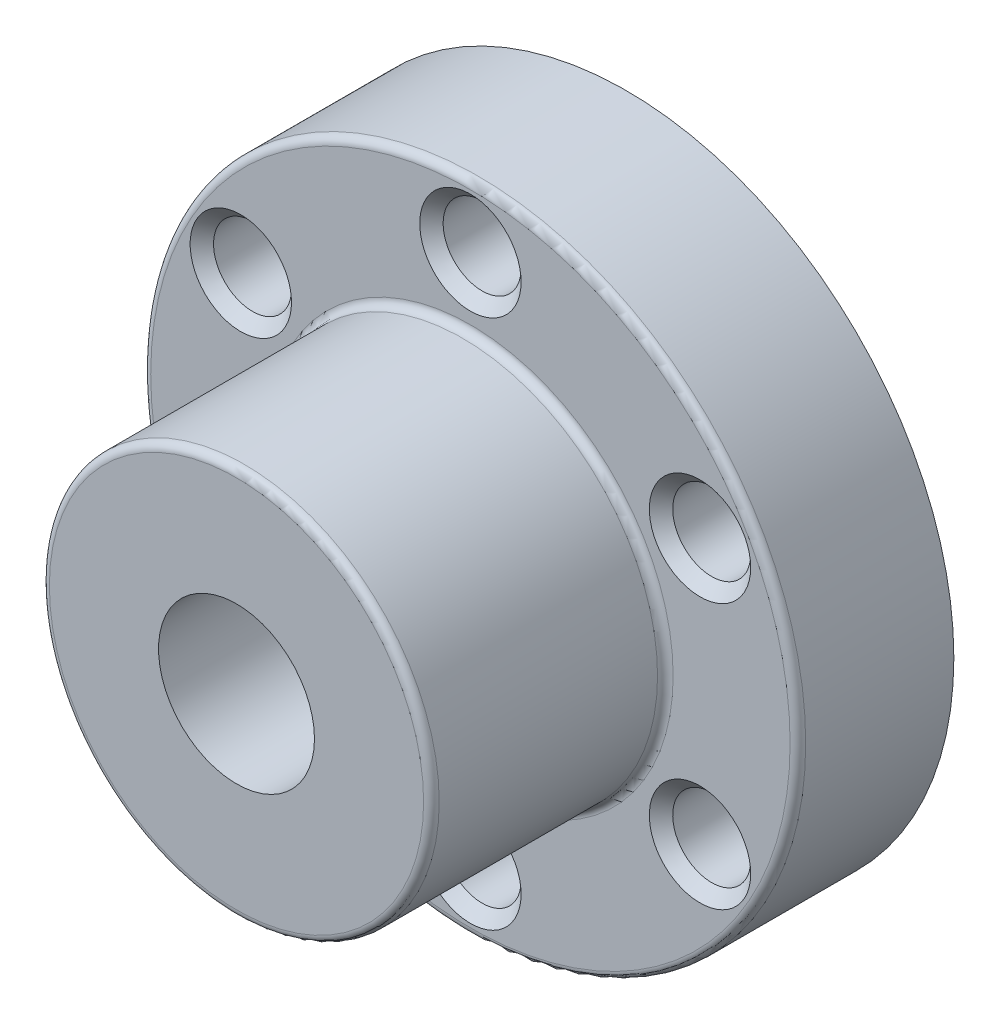
from build123d import *

# Parameters (mm, degrees)
SKETCH1_R                    = 21
BOSS_EXTRUDE1_DEPTH          = 10
SKETCH2_R                    = 12.5
BOSS_EXTRUDE2_DEPTH          = 15
SKETCH3_R                    = 5
CUT_EXTRUDE1_DEPTH           = 39.820097888
SKETCH4_R                    = 2.5
CUT_EXTRUDE2_DEPTH           = 39.820097888
FILLET1_R                    = 0.5
CHAMFER2_SIZE                = 0.75
CIRPATTERN2_COUNT            = 6
CHAMFER2_OF_CIRPATTERN2_SIZE = 0.75


with BuildPart() as part:
    # Sketch1 → Boss-Extrude1 (new body)
    with BuildSketch(Plane.XY):
        Circle(SKETCH1_R)
    extrude(amount=BOSS_EXTRUDE1_DEPTH)

    # Sketch2 → Boss-Extrude2 (add)
    with BuildSketch(Plane.XY.offset(10)):
        Circle(SKETCH2_R)
    extrude(amount=BOSS_EXTRUDE2_DEPTH)

    # Sketch3 → Cut-Extrude1 (cut, through all)
    with BuildSketch(Plane.XY.offset(25)):
        Circle(SKETCH3_R)
    extrude(amount=-CUT_EXTRUDE1_DEPTH, mode=Mode.SUBTRACT)

    # Sketch4 → Cut-Extrude2 (cut, through all)
    with BuildSketch(Plane(origin=(0, 0, 0), x_dir=(-1, 0, 0), z_dir=(0, 0, -1))):
        with Locations((0, 17)):
            Circle(SKETCH4_R)
    cut_extrude2 = extrude(amount=-CUT_EXTRUDE2_DEPTH, mode=Mode.SUBTRACT)

    # Fillet1
    fillet1_edges = [part.edges().sort_by_distance(p)[0] for p in [
        (-21, 0, 10),
        (-12.5, 0, 10),
        (-12.5, 0, 25),
    ]]
    fillet(fillet1_edges, radius=FILLET1_R)

    # Chamfer2
    chamfer2_edges = [part.edges().sort_by_distance(p)[0] for p in [
        (2.5, 17, 10),
    ]]
    chamfer(chamfer2_edges, length=CHAMFER2_SIZE)

    # CirPattern2: Cut-Extrude2 ×6 about axis
    cirpattern2_axis = Axis((0, 0, 10), (0, 0, -1))
    for i in range(1, CIRPATTERN2_COUNT):
        add(cut_extrude2.rotate(cirpattern2_axis, i * 360 / CIRPATTERN2_COUNT), mode=Mode.SUBTRACT)

    # Chamfer2 of CirPattern2
    chamfer2_of_cirpattern2_edges = [part.edges().sort_by_distance(p)[0] for p in [
        (15.972431864, 6.334936491, 10),
        (13.472431864, -10.665063509, 10),
        (-2.5, -17, 10),
        (-15.972431864, -6.334936491, 10),
        (-13.472431864, 10.665063509, 10),
    ]]
    chamfer(chamfer2_of_cirpattern2_edges, length=CHAMFER2_OF_CIRPATTERN2_SIZE)


solid = part.part
